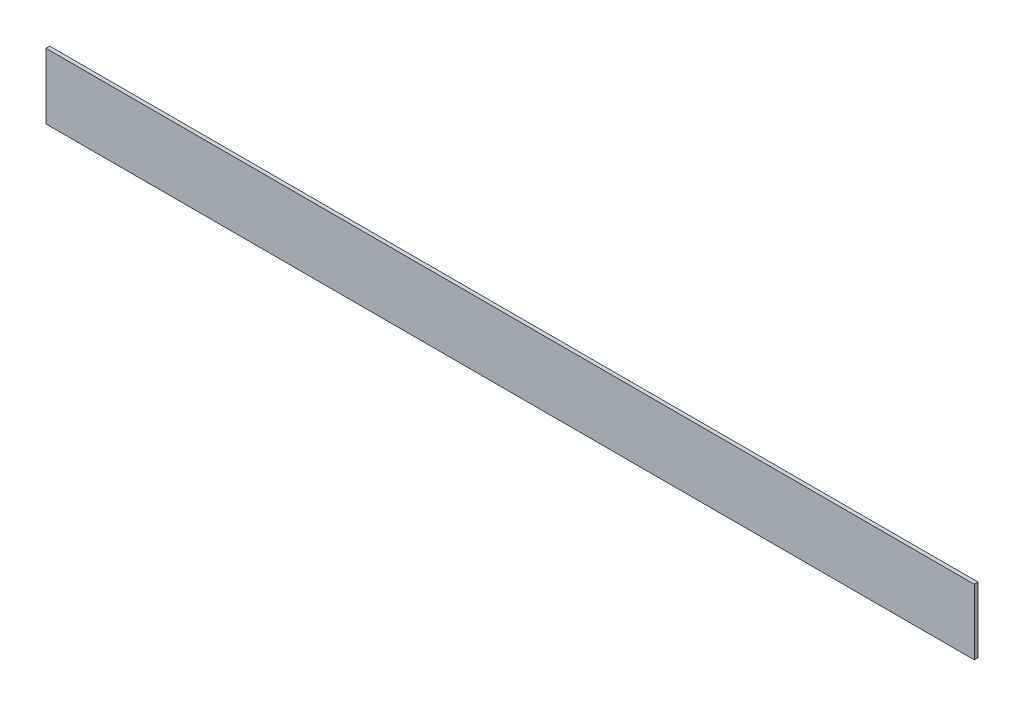
from build123d import *

# Parameters (mm, degrees)
SKETCH_1_W             = 496
SKETCH_1_H             = 2
SM_BASE_FLANGE_1_DEPTH = 35


# Sheet-metal steps are written as plain solids
with BuildPart() as part:
    # Sketch 1 → 基体-法兰1 (new body)
    with BuildSketch(Plane(origin=(0, 0, 0), x_dir=(1, 0, 0), z_dir=(0, 1, 0))):
        with Locations((-342.5, -93.5)):
            Rectangle(SKETCH_1_W, SKETCH_1_H)
    extrude(amount=SM_BASE_FLANGE_1_DEPTH)


solid = part.part
